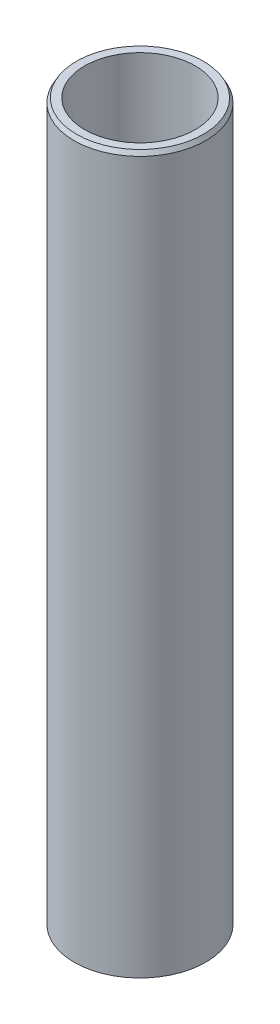
from build123d import *
from OCP.BRepFilletAPI import BRepFilletAPI_MakeChamfer

# Parameters (mm, degrees)
SKETCH1_R           = 55
BOSS_EXTRUDE1_DEPTH = 600
SKETCH2_R           = 46.197772521
CUT_EXTRUDE1_DEPTH  = 606.020660804
CHAMFER1_SIZE       = 3.553104386
CHAMFER1_SIZE2      = 2.051385774


with BuildPart() as part:
    # Sketch1 → Boss-Extrude1 (new body)
    with BuildSketch(Plane(origin=(0, 0, 0), x_dir=(1, 0, 0), z_dir=(0, 1, 0))):
        Circle(SKETCH1_R)
    extrude(amount=BOSS_EXTRUDE1_DEPTH)

    # Sketch2 → Cut-Extrude1 (cut, through all)
    with BuildSketch(Plane(origin=(0, 0, 0), x_dir=(1, 0, 0), z_dir=(0, 1, 0))):
        Circle(SKETCH2_R)
    extrude(amount=CUT_EXTRUDE1_DEPTH, mode=Mode.SUBTRACT)

    # Chamfer1: one chamfer whose edges measure the first distance from different faces: ONE call of the kernel's chamfer builder (chamfer() names one face for all edges)
    chamfer1_edges_1 = [part.edges().sort_by_distance(p)[0] for p in [
        (-55, 600, 0),
    ]]
    chamfer1_side_1 = [part.faces().sort_by_distance(p)[0] for p in [
        (-55, 300, 0),
    ]]
    chamfer1_edges_2 = [part.edges().sort_by_distance(p)[0] for p in [
        (-55, 0, 0),
    ]]
    chamfer1_side_2 = [part.faces().sort_by_distance(p)[0] for p in [
        (-53.444365081, 0, 0),
    ]]
    chamfer1 = BRepFilletAPI_MakeChamfer(part.part.solid().wrapped)
    for e in chamfer1_edges_1:
        chamfer1.Add(CHAMFER1_SIZE, CHAMFER1_SIZE2, e.wrapped, chamfer1_side_1[0].wrapped)  # the first distance lies on this face
    for e in chamfer1_edges_2:
        chamfer1.Add(CHAMFER1_SIZE, CHAMFER1_SIZE2, e.wrapped, chamfer1_side_2[0].wrapped)  # the first distance lies on this face
    add(Compound.cast(chamfer1.Shape()), mode=Mode.REPLACE)


solid = part.part
